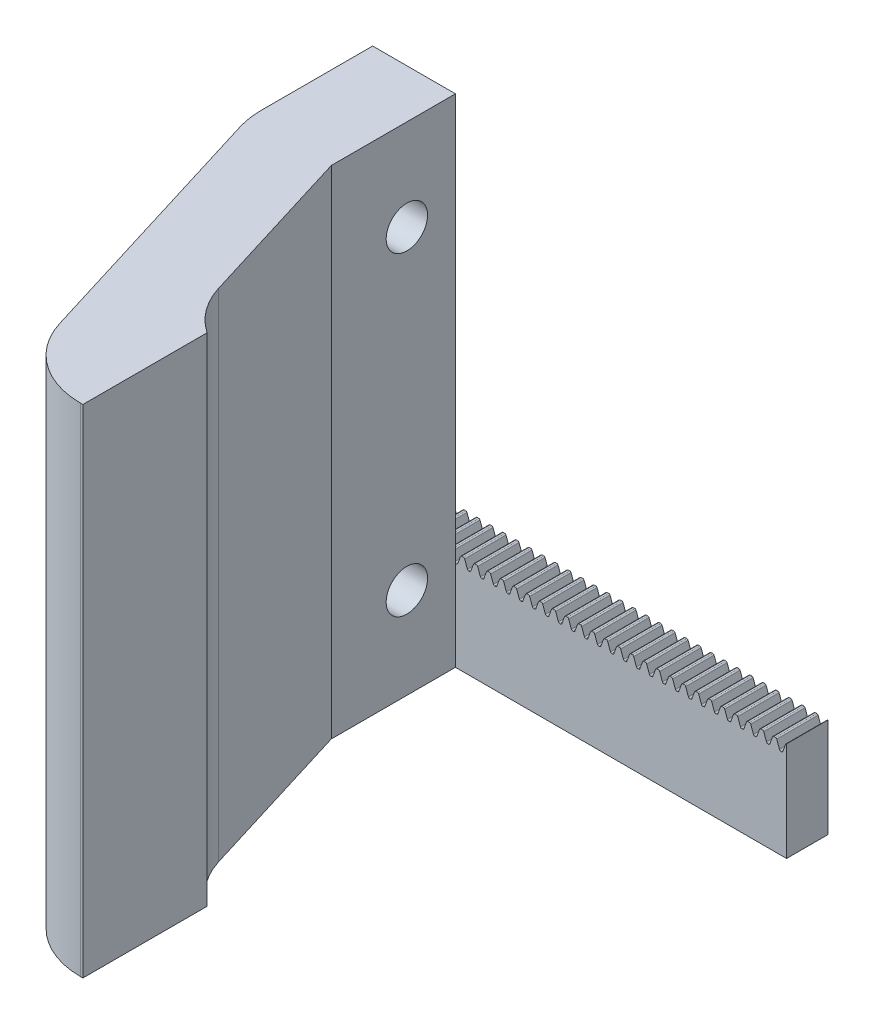
from build123d import *

# Parameters (mm, degrees)
BOSS_EXTRUDE1_DEPTH      = 2.5
BOSS_EXTRUDE1_DEPTH_BACK = 2.5
SKETCH3_W                = 50
SKETCH3_H                = 12
CUT_EXTRUDE1_DEPTH       = 26.831182706
LPATTERN1_COUNT          = 32
LPATTERN1_PITCH          = 1.570796327
LPATTERN1_COUNT_DIR2     = 2
LPATTERN1_PITCH_DIR2     = 1.570796327
SKETCH5_W                = 10
SKETCH5_H                = 60
BOSS_EXTRUDE2_DEPTH      = 15
SKETCH6_W                = 20
SKETCH6_H                = 60
BOSS_EXTRUDE3_DEPTH      = 40
CUT_EXTRUDE2_DEPTH       = 60
FILLET3_R                = 10
FILLET4_R                = 10
FILLET5_R                = 10
SKETCH8_R                = 2.5
CUT_EXTRUDE3_DEPTH       = 94.392986889


with BuildPart() as part:
    # Sketch3 → Boss-Extrude1 (new, two sides: drawn at the far end of the back side and taken through both)
    with BuildSketch(Plane.XY.offset(-BOSS_EXTRUDE1_DEPTH_BACK)):
        Rectangle(SKETCH3_W, SKETCH3_H)
    extrude(amount=BOSS_EXTRUDE1_DEPTH + BOSS_EXTRUDE1_DEPTH_BACK)

    # Sketch4 → Cut-Extrude1 (cut, symmetric)
    with BuildSketch(Plane.XY):
        with BuildLine():
            Line((-23.812833092, 5.889622222), (-23.772658866, 6))
            Line((-23.772658866, 6), (-24.347343065, 6))
            Line((-24.347343065, 6), (-24.347343065, 4.875))
            Line((-24.347343065, 4.875), (-24.299586958, 4.875))
            ThreePointArc((-24.299586958, 4.875), (-24.203368066, 4.9053377), (-24.141951154, 4.985377778))
            Line((-24.141951154, 4.985377778), (-23.812833092, 5.889622222))
        make_face()
        with BuildLine():
            Line((-23.655197289, 6), (-23.772658866, 6))
            Line((-23.772658866, 6), (-23.812833092, 5.889622222))
            ThreePointArc((-23.812833092, 5.889622222), (-23.75141618, 5.9696623), (-23.655197289, 6))
        make_face()
        with BuildLine():
            Line((-23.311056712, 5.889622222), (-23.351230937, 6))
            Line((-23.351230937, 6), (-23.468692515, 6))
            ThreePointArc((-23.468692515, 6), (-23.372473624, 5.9696623), (-23.311056712, 5.889622222))
        make_face()
        with BuildLine():
            Line((-22.776546739, 4.875), (-22.776546739, 6))
            Line((-22.776546739, 6), (-23.351230937, 6))
            Line((-23.351230937, 6), (-23.311056712, 5.889622222))
            Line((-23.311056712, 5.889622222), (-22.981938649, 4.985377778))
            ThreePointArc((-22.981938649, 4.985377778), (-22.920521738, 4.9053377), (-22.824302846, 4.875))
            Line((-22.824302846, 4.875), (-22.776546739, 4.875))
        make_face()
    cut_extrude1 = extrude(amount=CUT_EXTRUDE1_DEPTH, both=True, mode=Mode.SUBTRACT)

    # LPattern1: Cut-Extrude1 32 × 2
    with Locations(*[Vector(1, 0, 0) * (i * LPATTERN1_PITCH) + Vector(-1, 0, 0) * (j * LPATTERN1_PITCH_DIR2) for i in range(LPATTERN1_COUNT) for j in range(LPATTERN1_COUNT_DIR2) if (i, j) != (0, 0)]):
        add(cut_extrude1, mode=Mode.SUBTRACT)

    # Sketch5 → Boss-Extrude2 (add)
    with BuildSketch(Plane.XY.offset(2.5)):
        with Locations((-20, 24)):
            Rectangle(SKETCH5_W, SKETCH5_H)
    extrude(amount=BOSS_EXTRUDE2_DEPTH)

    # Sketch6 → Boss-Extrude3 (add)
    with BuildSketch(Plane.XY.offset(17.5)):
        with Locations((-15, 24)):
            Rectangle(SKETCH6_W, SKETCH6_H)
    extrude(amount=BOSS_EXTRUDE3_DEPTH)

    # Sketch7 → Cut-Extrude2 (cut)
    with BuildSketch(Plane.XZ.offset(6)):
        Polygon((-12.702699003, 57.5), (-25, 17.5), (-25, 57.5), align=None)
        Polygon((-15, 17.5), (-7.314186877, 42.5), (-5, 42.5), (-5, 17.5), align=None)
    extrude(amount=-CUT_EXTRUDE2_DEPTH, mode=Mode.SUBTRACT)

    # Fillet3
    fillet3_edges = [part.edges().sort_by_distance(p)[0] for p in [
        (-25, 24, 17.5),
    ]]
    fillet(fillet3_edges, radius=FILLET3_R)

    # Fillet4
    fillet4_edges = [part.edges().sort_by_distance(p)[0] for p in [
        (-12.702699003, 24, 57.5),
    ]]
    fillet(fillet4_edges, radius=FILLET4_R)

    # Fillet5
    # the kernel refuses this fillet: 10 mm, written as the material it adds along each edge
    with BuildSketch(Plane(origin=(-7.314186877, -6, 42.5), x_dir=(1, 0, 0), z_dir=(0, 1, 0))) as fillet5_piece_1:
        with BuildLine():
            CenterArc((7.91502421, 8.284360034), FILLET5_R, 197.089130825, 38.849280518)
            Line((-1.643463569, 5.345770001), (-1.834633325, 5.286998201))
            Line((-1.834633325, 5.286998201), (-0.191169756, -0.058771801))
            Line((-0.191169756, -0.058771801), (0, -0.2))
            ThreePointArc((0, -0.2), (1.157093438, -0.2), (2.20217013, -0.165687201))
            Line((2.20217013, -0.165687201), (2.314186877, 0))
        make_face()
    extrude(amount=60)

    # Sketch8 → Cut-Extrude3 (cut, through all)
    with BuildSketch(Plane.ZY.offset(25)):
        with Locations(Location((8.366986875, 43, 0), (0, 0, 270))):
            Circle(SKETCH8_R)
        with Locations(Location((8.366986875, 5, 0), (0, 0, 270))):
            Circle(SKETCH8_R)
    extrude(amount=-CUT_EXTRUDE3_DEPTH, mode=Mode.SUBTRACT)


solid = part.part
